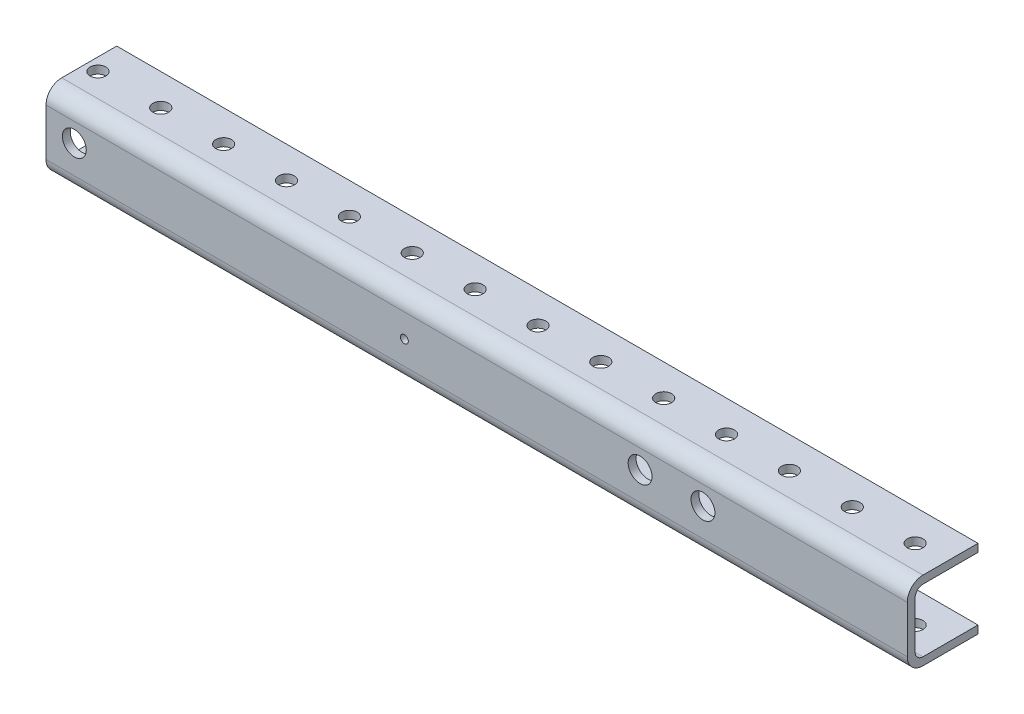
from build123d import *

# Parameters (mm, degrees)
SKETCH1_W          = 889
SKETCH1_H          = 31.75
EXTRUDE1_DEPTH     = 28.575
EXTRUDE2_REACH     = 891.702
SKETCH2_W          = 25.4
SKETCH2_H          = 25.4
HOLE1_D            = 6.35
HOLE1_DEPTH        = 3.175
LPATTERN1_COUNT    = 35
LPATTERN1_PITCH    = 25.4
HOLE2_D            = 9.652
LPATTERN2_COUNT    = 12
LPATTERN2_PITCH    = 25.4
HOLE3_D            = 9.652
HOLE4_D            = 9.652
LPATTERN3_COUNT    = 12
LPATTERN3_PITCH    = 25.4
HOLE5_D            = 3.175
HOLE6_D            = 6.35
LPATTERN4_COUNT    = 35
LPATTERN4_PITCH    = 25.4
FILLET1_R          = 3.175
FILLET2_R          = 3.175
FILLET3_R          = 6.35
FILLET4_R          = 6.35
SKETCH16_W         = 145.760071232
SKETCH16_H         = 71.504803879
CUT_EXTRUDE2_DEPTH = 75
SKETCH17_W         = 473.628565651
SKETCH17_H         = 66.908943447
CUT_EXTRUDE3_DEPTH = 186


with BuildPart() as part:
    # Sketch1 → Extrude1 (new body)
    with BuildSketch(Plane.XY.offset(3.175)):
        with Locations((428.480011997, 8.672957166)):
            Rectangle(SKETCH1_W, SKETCH1_H)
    extrude(amount=-EXTRUDE1_DEPTH)

    # Sketch2 → Extrude2 (cut, up to next)
    with BuildSketch(Plane.ZY.offset(16.019988003), mode=Mode.PRIVATE) as extrude2_sk1:
        with Locations((-12.7, 8.672957166)):
            Rectangle(SKETCH2_W, SKETCH2_H)
    extrude2_tool1 = extrude(extrude2_sk1.sketch, amount=-EXTRUDE2_REACH, mode=Mode.PRIVATE) & part.part
    add(extrude2_tool1.solids().sort_by_distance((-16.019988, 8.672957, -12.7))[0], mode=Mode.SUBTRACT)

    # Hole1
    with Locations(Plane(origin=(0, 24.547957166, 0), x_dir=(-1, 0, 0), z_dir=(0, 1, 0))):
        with Locations((3.319988003, -12.7)):
            hole1 = Hole(HOLE1_D / 2, depth=HOLE1_DEPTH)

    # LPattern1: Hole1 ×35
    with Locations(*[(i * LPATTERN1_PITCH, 0, 0) for i in range(1, LPATTERN1_COUNT)]):
        add(hole1, mode=Mode.SUBTRACT)

    # Hole2 (through all)
    with Locations(Plane.XY.offset(3.175)):
        with Locations((66.530011997, 10.577957166)):
            hole2 = Hole(HOLE2_D / 2)

    # LPattern2: Hole2 ×12, 8 skipped
    with Locations(*[(i * LPATTERN2_PITCH, 0, 0) for i in range(1, LPATTERN2_COUNT) if i not in (2, 3, 4, 5, 6, 7, 8, 9)]):
        add(hole2, mode=Mode.SUBTRACT)

    # Hole3 (through all)
    with Locations(Plane.XY.offset(3.175)):
        with Locations((428.480011997, 6.767957166)):
            Hole(HOLE3_D / 2)

    # Hole4 (through all)
    with Locations(Plane.XY.offset(3.175)):
        with Locations((511.030011997, 10.577957166)):
            hole4 = Hole(HOLE4_D / 2)

    # LPattern3: Hole4 ×12, 8 skipped
    with Locations(*[(i * LPATTERN3_PITCH, 0, 0) for i in range(1, LPATTERN3_COUNT) if i not in (2, 3, 4, 5, 6, 7, 8, 9)]):
        add(hole4, mode=Mode.SUBTRACT)

    # Hole5 (through all)
    with Locations(Plane.XY.offset(3.175)):
        with Locations((669.780011997, 8.672957166)):
            Hole(HOLE5_D / 2)

    # Hole6 (through all)
    with Locations(Plane(origin=(0, -4.027042834, 0), x_dir=(-1, 0, 0), z_dir=(0, 1, 0))):
        with Locations((3.319988003, -12.7)):
            hole6 = Hole(HOLE6_D / 2)

    # LPattern4: Hole6 ×35
    with Locations(*[(i * LPATTERN4_PITCH, 0, 0) for i in range(1, LPATTERN4_COUNT)]):
        add(hole6, mode=Mode.SUBTRACT)

    # Fillet1
    fillet1_edges = [part.edges().sort_by_distance(p)[0] for p in [
        (428.480011997, 21.372957166, 0),
    ]]
    fillet(fillet1_edges, radius=FILLET1_R)

    # Fillet2
    fillet2_edges = [part.edges().sort_by_distance(p)[0] for p in [
        (428.480011997, -4.027042834, 0),
    ]]
    fillet(fillet2_edges, radius=FILLET2_R)

    # Fillet3
    fillet3_edges = [part.edges().sort_by_distance(p)[0] for p in [
        (428.480011997, -7.202042834, 3.175),
    ]]
    fillet(fillet3_edges, radius=FILLET3_R)

    # Fillet4
    fillet4_edges = [part.edges().sort_by_distance(p)[0] for p in [
        (428.480011997, 24.547957166, 3.175),
    ]]
    fillet(fillet4_edges, radius=FILLET4_R)

    # Sketch16 → Cut-Extrude2 (cut)
    with BuildSketch(Plane(origin=(0, 24.547957166, 0), x_dir=(1, 0, 0), z_dir=(0, 1, 0))):
        with Locations((40.099976381, -10.352401939)):
            Rectangle(SKETCH16_W, SKETCH16_H)
    extrude(amount=-CUT_EXTRUDE2_DEPTH, mode=Mode.SUBTRACT)

    # Sketch17 → Cut-Extrude3 (cut)
    with BuildSketch(Plane(origin=(0, 24.547957166, 0), x_dir=(1, 0, 0), z_dir=(0, 1, 0))):
        with Locations((288.165729172, -8.054471723)):
            Rectangle(SKETCH17_W, SKETCH17_H)
    extrude(amount=-CUT_EXTRUDE3_DEPTH, mode=Mode.SUBTRACT)


solid = part.part
